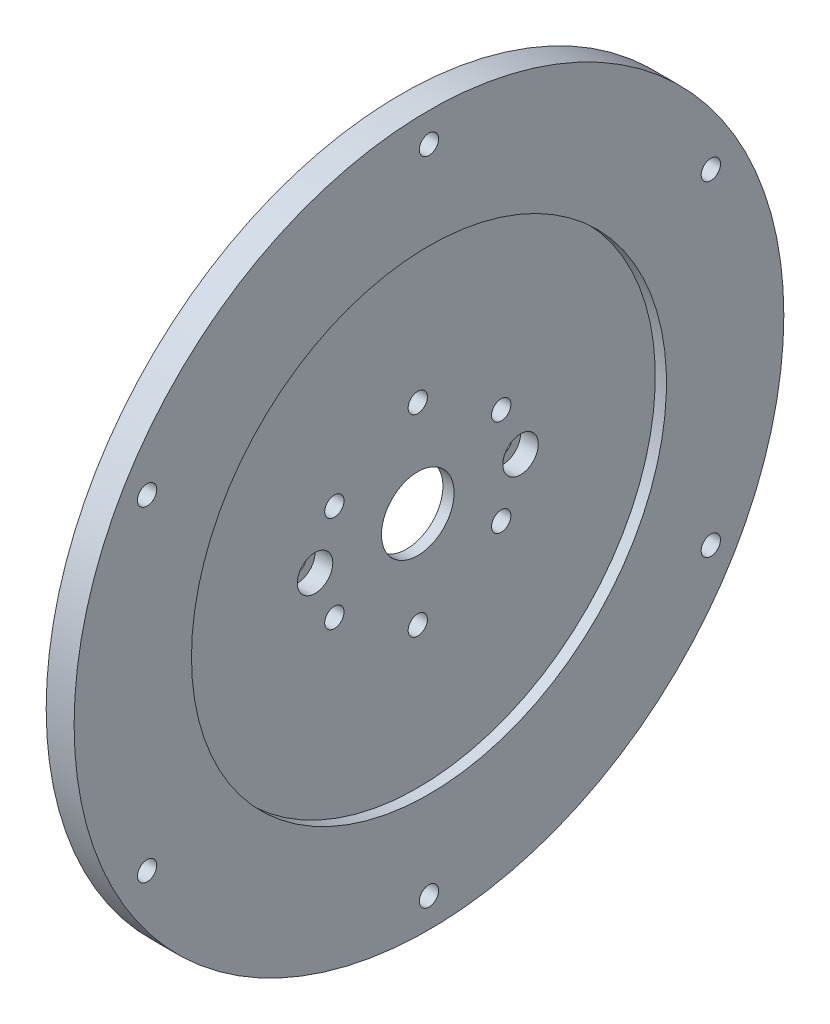
from build123d import *

# Parameters (mm, degrees)
CUT_EXTRUDE1_DEPTH      = 91.587581974
CUT_EXTRUDE1_DEPTH_BACK = 91.587581974
SKETCH4_R               = 1.7272
SKETCH5_R               = 1.5875
CUT_EXTRUDE2_DEPTH      = 92.030269719
SKETCH6_R               = 3.175
CUT_EXTRUDE3_DEPTH      = 3.175


with BuildPart() as part:
    # Sketch2 → Revolve1 (revolve)
    with BuildSketch(Plane.XY):
        Polygon((-2.54e-07, 29.999999944), (-1.900000264, 29.999999944), (-11.90000033, 29.999999944), (-11.90000033, 25.4), (-2.000000064, 25.4), (-2.000000064, 11.499999987), (1.000000032, 11.499999987), (1.000000032, 6.499999954), (2.999999842, 6.499999954), (2.999999842, 42.499999963), (4.999999652, 42.499999963), (4.999999652, 63.5), (-2.54e-07, 63.5), align=None)
    revolve(axis=Axis((0, 0, 0), (1, 0, 0)))

    # Sketch4 → Cut-Extrude1 (cut, two sides: drawn at the far end of the back side and taken through both)
    with BuildSketch(Plane(origin=(0, 0, 0), x_dir=(0, 0, -1), z_dir=(1, 0, 0)).offset(-CUT_EXTRUDE1_DEPTH_BACK)):
        with Locations((0, 58.238499982)):
            Circle(SKETCH4_R)
        with Locations((50.436020463, 29.119249991)):
            Circle(SKETCH4_R)
        with Locations((50.436020463, -29.119249991)):
            Circle(SKETCH4_R)
        with Locations((0, -58.238499982)):
            Circle(SKETCH4_R)
        with Locations((-50.436020463, -29.119249991)):
            Circle(SKETCH4_R)
        with Locations((-50.436020463, 29.119249991)):
            Circle(SKETCH4_R)
        with Locations((-14.928978871, 8.61924997)):
            Circle(SKETCH4_R)
        with Locations((0, 17.23849994)):
            Circle(SKETCH4_R)
        with Locations((14.928978871, 8.61924997)):
            Circle(SKETCH4_R)
        with Locations((14.928978871, -8.61924997)):
            Circle(SKETCH4_R)
        with Locations((0, -17.23849994)):
            Circle(SKETCH4_R)
        with Locations((-14.928978871, -8.61924997)):
            Circle(SKETCH4_R)
    extrude(amount=CUT_EXTRUDE1_DEPTH + CUT_EXTRUDE1_DEPTH_BACK, mode=Mode.SUBTRACT)

    # Sketch5 → Cut-Extrude2 (cut, through all)
    with BuildSketch(Plane(origin=(2.999999842, 0, 0), x_dir=(0, 0, -1), z_dir=(1, 0, 0))):
        with Locations((-18.385, 0)):
            Circle(SKETCH5_R)
        with Locations((18.385, 0)):
            Circle(SKETCH5_R)
    extrude(amount=-CUT_EXTRUDE2_DEPTH, mode=Mode.SUBTRACT)

    # Sketch6 → Cut-Extrude3 (cut)
    with BuildSketch(Plane(origin=(2.999999842, 0, 0), x_dir=(0, 0, -1), z_dir=(1, 0, 0))):
        with Locations((-18.385, 0)):
            Circle(SKETCH6_R)
        with Locations((18.385, 0)):
            Circle(SKETCH6_R)
    extrude(amount=-CUT_EXTRUDE3_DEPTH, mode=Mode.SUBTRACT)


solid = part.part
